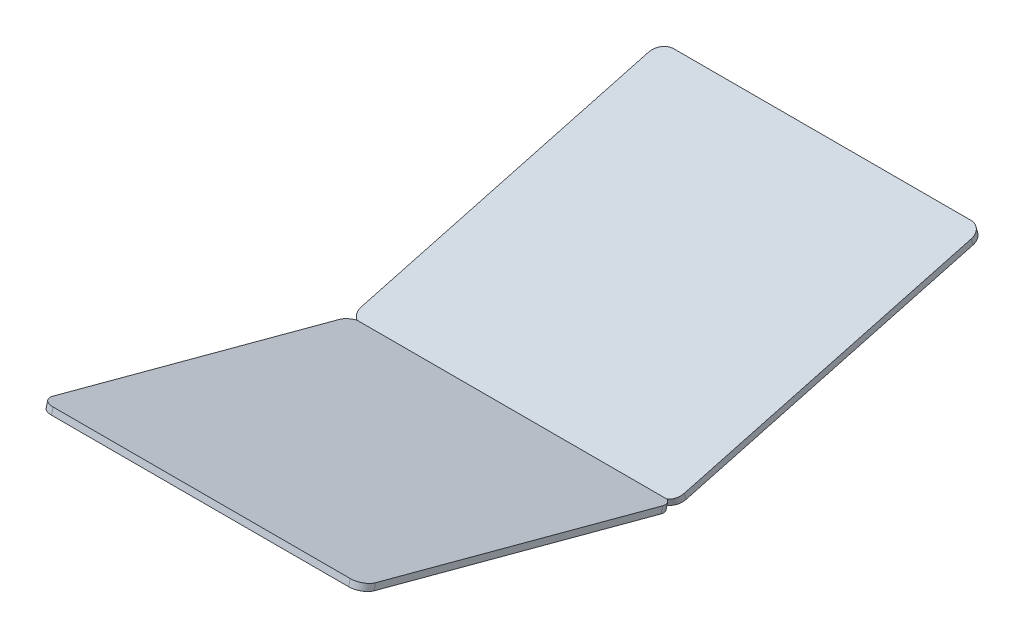
from build123d import *

# Parameters (mm, degrees)
EXTRUDE_1_DEPTH          = 0.5
MOVE_BODY_1_ANGLE        = 15
PATTERN_CIRCULAR_1_COUNT = 2
OTHER_2_DEPTH            = 0.5
OTHER_2_2_DEPTH          = 0.5


# Read off the part's stored shape, not the designer's step: 相交2
with BuildPart() as part:
    # 草图1 → 凸台-拉伸1 (new body)
    with BuildSketch(Plane(origin=(0, 0, 0), x_dir=(1, 0, 0), z_dir=(0, 1, 0))):
        with BuildLine():
            Line((-11.5, 0), (11.5, 0))
            ThreePointArc((11.5, 0), (12.207106781, 0.292893219), (12.5, 1))
            Line((12.5, 1), (12.5, 24))
            ThreePointArc((12.5, 24), (12.207106781, 24.707106781), (11.5, 25))
            Line((11.5, 25), (-11.5, 25))
            ThreePointArc((-11.5, 25), (-12.207106781, 24.707106781), (-12.5, 24))
            Line((-12.5, 24), (-12.5, 1))
            ThreePointArc((-12.5, 1), (-12.207106781, 0.292893219), (-11.5, 0))
        make_face()
    extrude(amount=EXTRUDE_1_DEPTH)


with BuildPart() as part_1:
    # Move Body 1: moved
    add(part.part.rotate(Axis((0, 0, 0), (1, 0, 0)), MOVE_BODY_1_ANGLE))


with BuildPart() as pattern_circular_1_1:
    # 阵列(圆周)1: pattern copy
    add(part_1.part.rotate(Axis((0, 0, 0), (0, 1, 0)), 1 * 360 / PATTERN_CIRCULAR_1_COUNT))

    # 相交2 outline → 相交2 (cut)
    with BuildSketch(Plane(origin=(0, 0, 0), x_dir=(1, 0, 0), z_dir=(0, 0.9659258262890682, 0.2588190451025211))):
        with BuildLine():
            Line((-11.5, 0), (11.5, 0))
            ThreePointArc((11.5, 0), (11.758819045, 0.034074174), (12, 0.133974596))
            Line((12, 0.133974596), (13, 0.711324861))
            Line((13, 0.711324861), (13, 2))
            Line((13, 2), (-13, 2))
            Line((-13, 2), (-13, 0.711324861))
            Line((-13, 0.711324861), (-12, 0.133974596))
            ThreePointArc((-12, 0.133974596), (-11.758819045, 0.034074174), (-11.5, 0))
        make_face()
    extrude(amount=OTHER_2_DEPTH, mode=Mode.SUBTRACT)


with BuildPart() as part_2:
    add(part_1.part)

    # Other 2 2 outline → Other 2 2 (cut)
    with BuildSketch(Plane(origin=(0, 0, 0), x_dir=(1, 0, 0), z_dir=(0, 0.9659258262890682, -0.2588190451025211))):
        with BuildLine():
            Line((11.5, 0), (-11.5, 0))
            ThreePointArc((-11.5, 0), (-11.758819045, -0.034074174), (-12, -0.133974596))
            Line((-12, -0.133974596), (-13, -0.711324861))
            Line((-13, -0.711324861), (-13, -2))
            Line((-13, -2), (13, -2))
            Line((13, -2), (13, -0.711324861))
            Line((13, -0.711324861), (12, -0.133974596))
            ThreePointArc((12, -0.133974596), (11.758819045, -0.034074174), (11.5, 0))
        make_face()
    extrude(amount=OTHER_2_2_DEPTH, mode=Mode.SUBTRACT)


solid = Compound([pattern_circular_1_1.part, part_2.part])
